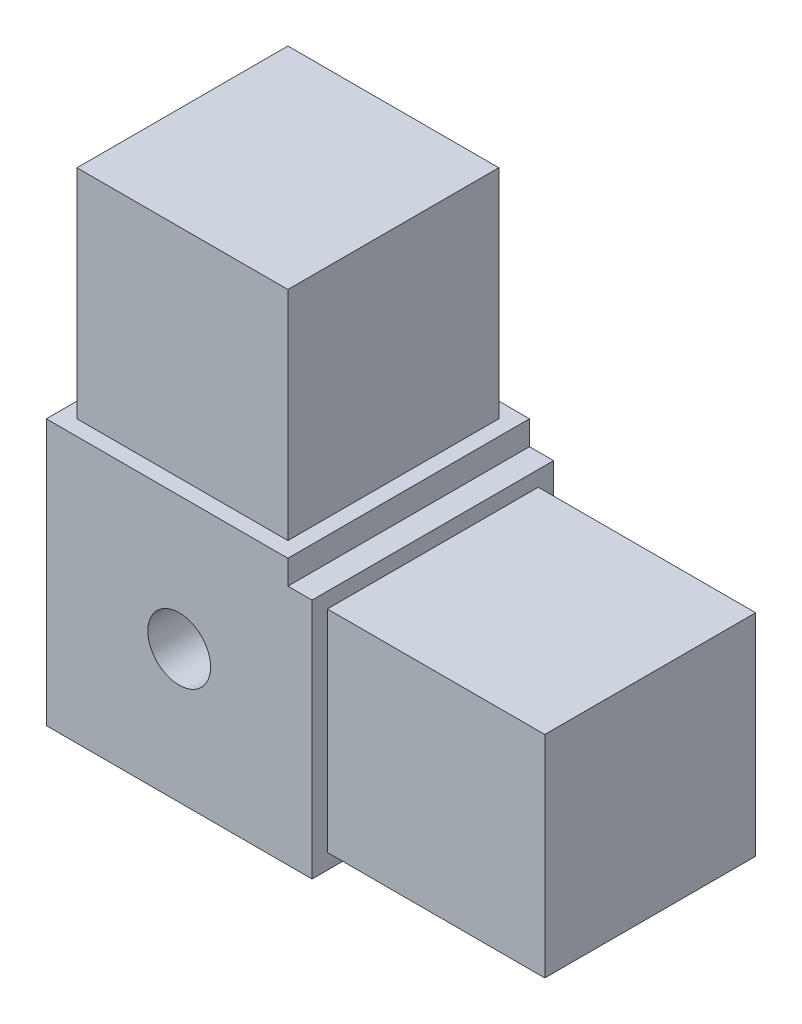
from build123d import *

# Parameters (mm, degrees)
SKETCH1_W           = 50.8
SKETCH1_H           = 50.8
BOSS_EXTRUDE1_DEPTH = 12.7
SKETCH2_W           = 25.4
SKETCH2_H           = 25.4
CUT_EXTRUDE1_DEPTH  = 44.994090512
SKETCH3_W           = 25.4
SKETCH3_H           = 25.4
SKETCH3_W_2         = 22.1742
SKETCH3_H_2         = 22.1742
CUT_EXTRUDE2_DEPTH  = 22.86
SKETCH5_W           = 25.4
SKETCH5_H           = 25.4
SKETCH5_W_2         = 22.1742
SKETCH5_H_2         = 22.1742
CUT_EXTRUDE4_DEPTH  = 22.86
SKETCH7_R           = 3.3
CUT_EXTRUDE6_DEPTH  = 44.994090512


with BuildPart() as part:
    # Sketch1 → Boss-Extrude1 (new, symmetric)
    with BuildSketch(Plane.XY):
        Rectangle(SKETCH1_W, SKETCH1_H)
    extrude(amount=BOSS_EXTRUDE1_DEPTH, both=True)

    # Sketch2 → Cut-Extrude1 (cut, through all)
    with BuildSketch(Plane.XY.offset(12.7)):
        with Locations((12.7, 12.7)):
            Rectangle(SKETCH2_W, SKETCH2_H)
    extrude(amount=-CUT_EXTRUDE1_DEPTH, mode=Mode.SUBTRACT)

    # Sketch3 → Cut-Extrude2 (cut)
    with BuildSketch(Plane(origin=(25.4, 0, 0), x_dir=(0, 0, -1), z_dir=(1, 0, 0))):
        with Locations((0, -12.7)):
            Rectangle(SKETCH3_W, SKETCH3_H)
        with Locations((0, -12.7)):
            Rectangle(SKETCH3_W_2, SKETCH3_H_2, mode=Mode.SUBTRACT)
    extrude(amount=-CUT_EXTRUDE2_DEPTH, mode=Mode.SUBTRACT)

    # Sketch5 → Cut-Extrude4 (cut)
    with BuildSketch(Plane(origin=(0, 25.4, 0), x_dir=(1, 0, 0), z_dir=(0, 1, 0))):
        with Locations((-12.7, 0)):
            Rectangle(SKETCH5_W, SKETCH5_H)
        with Locations((-12.7, 0)):
            Rectangle(SKETCH5_W_2, SKETCH5_H_2, mode=Mode.SUBTRACT)
    extrude(amount=-CUT_EXTRUDE4_DEPTH, mode=Mode.SUBTRACT)

    # Sketch7 → Cut-Extrude6 (cut, through all)
    with BuildSketch(Plane.XY.offset(12.7)):
        with Locations((-11.43, -11.43)):
            Circle(SKETCH7_R)
    extrude(amount=-CUT_EXTRUDE6_DEPTH, mode=Mode.SUBTRACT)


solid = part.part
